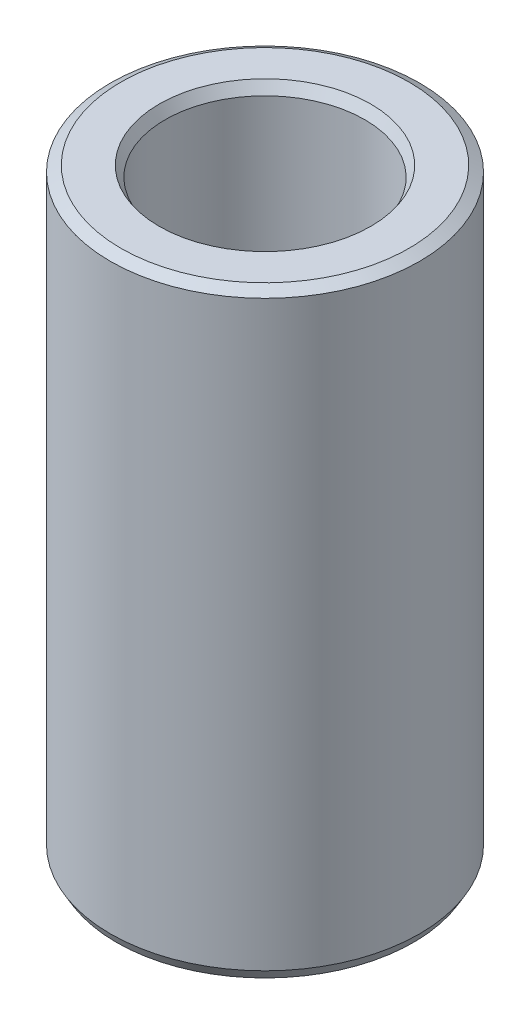
from build123d import *
from OCP.BRepFilletAPI import BRepFilletAPI_MakeChamfer

# Parameters (mm, degrees)
SKETCH1_R           = 60
BOSS_EXTRUDE1_DEPTH = 232.551561142
SKETCH2_R           = 38.762796693
CUT_EXTRUDE1_DEPTH  = 248.548436855
CHAMFER1_SIZE       = 2.349356313
CHAMFER1_SIZE2      = 4.0692045


with BuildPart() as part:
    # Sketch1 → Boss-Extrude1 (new body)
    with BuildSketch(Plane(origin=(0, 0, 0), x_dir=(1, 0, 0), z_dir=(0, 1, 0))):
        Circle(SKETCH1_R)
    extrude(amount=BOSS_EXTRUDE1_DEPTH)

    # Sketch2 → Cut-Extrude1 (cut, through all)
    with BuildSketch(Plane(origin=(0, 0, 0), x_dir=(1, 0, 0), z_dir=(0, 1, 0))):
        Circle(SKETCH2_R)
    extrude(amount=CUT_EXTRUDE1_DEPTH, mode=Mode.SUBTRACT)

    # Chamfer1: one chamfer whose edges measure the first distance from different faces: ONE call of the kernel's chamfer builder (chamfer() names one face for all edges)
    chamfer1_edges_1 = [part.edges().sort_by_distance(p)[0] for p in [
        (-38.762796693, 232.551561142, 0),
    ]]
    chamfer1_side_1 = [part.faces().sort_by_distance(p)[0] for p in [
        (-58.302943725, 232.551561142, 0),
    ]]
    chamfer1_edges_2 = [part.edges().sort_by_distance(p)[0] for p in [
        (-38.762796693, 0, 0),
    ]]
    chamfer1_side_2 = [part.faces().sort_by_distance(p)[0] for p in [
        (-38.762796693, 116.275780571, 0),
    ]]
    chamfer1_edges_3 = [part.edges().sort_by_distance(p)[0] for p in [
        (-60, 0, 0),
    ]]
    chamfer1_side_3 = [part.faces().sort_by_distance(p)[0] for p in [
        (-58.302943725, 0, 0),
    ]]
    chamfer1_edges_4 = [part.edges().sort_by_distance(p)[0] for p in [
        (-60, 232.551561142, 0),
    ]]
    chamfer1_side_4 = [part.faces().sort_by_distance(p)[0] for p in [
        (-60, 116.275780571, 0),
    ]]
    chamfer1 = BRepFilletAPI_MakeChamfer(part.part.solid().wrapped)
    for e in chamfer1_edges_1:
        chamfer1.Add(CHAMFER1_SIZE, CHAMFER1_SIZE2, e.wrapped, chamfer1_side_1[0].wrapped)  # the first distance lies on this face
    for e in chamfer1_edges_2:
        chamfer1.Add(CHAMFER1_SIZE, CHAMFER1_SIZE2, e.wrapped, chamfer1_side_2[0].wrapped)  # the first distance lies on this face
    for e in chamfer1_edges_3:
        chamfer1.Add(CHAMFER1_SIZE, CHAMFER1_SIZE2, e.wrapped, chamfer1_side_3[0].wrapped)  # the first distance lies on this face
    for e in chamfer1_edges_4:
        chamfer1.Add(CHAMFER1_SIZE, CHAMFER1_SIZE2, e.wrapped, chamfer1_side_4[0].wrapped)  # the first distance lies on this face
    add(Compound.cast(chamfer1.Shape()), mode=Mode.REPLACE)


solid = part.part
